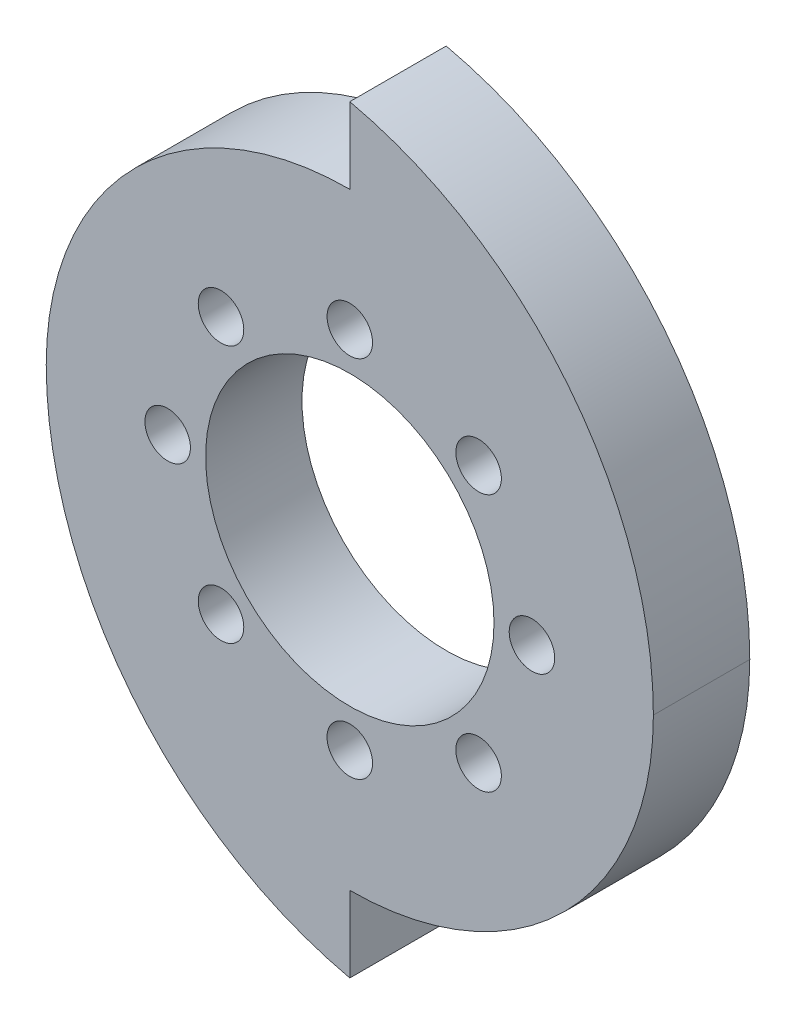
from build123d import *

# Parameters (mm, degrees)
BOSS_EXTRUDE1_DEPTH = 6.35
SKETCH4_R           = 9.5
SKETCH4_R_2         = 1.5
CUT_EXTRUDE1_DEPTH  = 33.639278485
CIRPATTERN1_COUNT   = 8


with BuildPart() as part:
    # Sketch3 → Boss-Extrude1 (new body)
    with BuildSketch(Plane.XY):
        with BuildLine():
            Line((0, 20), (0, 25))
            ThreePointArc((0, 25), (14.384763242, 16.007810594), (20, 0))
            ThreePointArc((20, 0), (14.142135624, -14.142135624), (0, -20))
            Line((0, -20), (0, -25))
            ThreePointArc((0, -25), (-14.384763242, -16.007810594), (-20, 0))
            ThreePointArc((-20, 0), (-14.142135624, 14.142135624), (0, 20))
        make_face()
    extrude(amount=BOSS_EXTRUDE1_DEPTH)

    # Sketch4 → Cut-Extrude1 (cut, through all)
    with BuildSketch(Plane.XY.offset(6.35)):
        Circle(SKETCH4_R)
        with Locations((0, 12)):
            Circle(SKETCH4_R_2)
    cut_extrude1 = extrude(amount=-CUT_EXTRUDE1_DEPTH, mode=Mode.SUBTRACT)

    # CirPattern1: Cut-Extrude1 ×8 about axis
    cirpattern1_axis = Axis((0, 0, -0.475), (0, 0, 1))
    for i in range(1, CIRPATTERN1_COUNT):
        add(cut_extrude1.rotate(cirpattern1_axis, i * 360 / CIRPATTERN1_COUNT), mode=Mode.SUBTRACT)


solid = part.part
